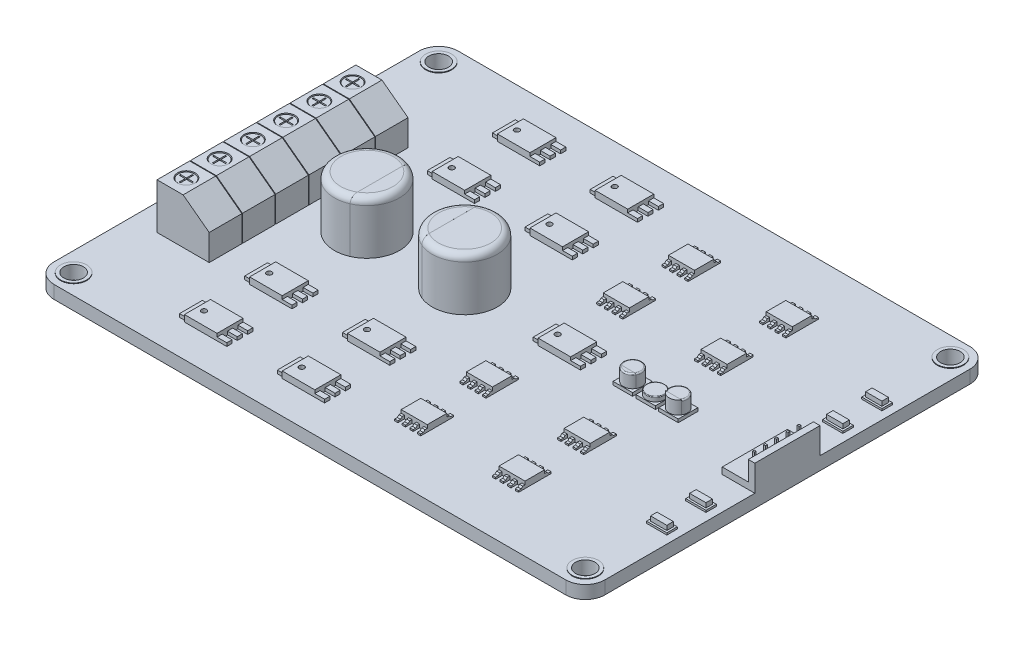
from build123d import *

# Parameters (mm, degrees)
SKETCH1_R                 = 1.5
BOSS_EXTRUDE1_DEPTH       = 2
BOSS_EXTRUDE3_DEPTH       = 5
SKETCH9_R                 = 1.35
SKETCH9_R_2               = 1.25
CUT_EXTRUDE2_DEPTH        = 2.5
SKETCH9_4_R               = 1.25
CUT_EXTRUDE4_DEPTH        = 0.1
SKETCH9_3_W               = 2
SKETCH9_3_H               = 0.2
CUT_EXTRUDE3_DEPTH        = 0.5
LPATTERN1_COUNT           = 3
LPATTERN1_PITCH           = 5.1
LPATTERN2_COUNT           = 4
LPATTERN2_PITCH           = 5.1
SKETCH10_R                = 2
SKETCH10_R_2              = 1.5
BOSS_EXTRUDE4_DEPTH       = 0.1
SKETCH11_R                = 5
BOSS_EXTRUDE5_DEPTH       = 8
FILLET1_R                 = 1
SKETCH12_W                = 5
SKETCH12_H                = 4
SKETCH12_R                = 0.4
BOSS_EXTRUDE6_DEPTH       = 1
SKETCH12_3_W              = 1.5
SKETCH12_3_H              = 0.800982622
SKETCH12_3_H_2            = 0.8
BOSS_EXTRUDE7_DEPTH       = 0.5
SKETCH13_W                = 3.5
SKETCH13_H                = 0.502519904
BOSS_EXTRUDE8_DEPTH       = 1
LPATTERN3_COUNT           = 2
LPATTERN3_PITCH           = 10
LPATTERN3_COUNT_DIR2      = 2
LPATTERN3_PITCH_DIR2      = 15
CUT_EXTRUDE5_START        = -8
CUT_EXTRUDE5_DEPTH        = 8
BOSS_EXTRUDE9_DEPTH       = 8
FILLET2_R                 = 1
SKETCH16_W                = 5
SKETCH16_H                = 4
SKETCH16_R                = 0.4
BOSS_EXTRUDE10_DEPTH      = 1
SKETCH16_3_W              = 1.5
SKETCH16_3_H              = 0.8
BOSS_EXTRUDE11_DEPTH      = 0.5
SKETCH17_W                = 3.5
SKETCH17_H                = 0.5
BOSS_EXTRUDE12_DEPTH      = 1
SKETCH18_W                = 4
SKETCH18_H                = 3
BOSS_EXTRUDE13_DEPTH      = 1
SKETCH18_3_W              = 0.5
SKETCH18_3_H              = 1
BOSS_EXTRUDE14_DEPTH      = 0.5
CUT_EXTRUDE6_REACH        = 62.725
LPATTERN4_COUNT           = 2
LPATTERN4_PITCH           = 10
LPATTERN4_COUNT_DIR2      = 2
LPATTERN4_PITCH_DIR2      = 15
SKETCH20_W                = 3
SKETCH20_H                = 3
BOSS_EXTRUDE15_DEPTH      = 0.5
LPATTERN5_COUNT           = 3
LPATTERN5_PITCH           = 3.5
SKETCH21_R                = 1.4
BOSS_EXTRUDE16_DEPTH      = 2
CUT_EXTRUDE7_START        = -2
CUT_EXTRUDE7_DEPTH        = 2
BOSS_EXTRUDE17_START      = -2
BOSS_EXTRUDE17_DEPTH      = 2
FILLET3_R                 = 0.2
FILLET4_R                 = 0.2
LPATTERN6_COUNT           = 2
LPATTERN6_PITCH           = 7
FILLET4_OF_LPATTERN6_R    = 0.2
SKETCH24_R                = 1.4
BOSS_EXTRUDE18_DEPTH      = 0.7
FILLET5_R                 = 0.1
SKETCH25_W                = 5
SKETCH25_H                = 10
BOSS_EXTRUDE19_DEPTH      = 1
SKETCH26_W                = 1
SKETCH26_H                = 10
BOSS_EXTRUDE20_DEPTH      = 3
SKETCH27_W                = 0.3
SKETCH27_H                = 0.3
BOSS_EXTRUDE21_DEPTH      = 3
SKETCH28_W                = 2.5
SKETCH28_H                = 1
BOSS_EXTRUDE22_DEPTH      = 1
SKETCH29_W                = 3.1
SKETCH29_H                = 1.6
BOSS_EXTRUDE23_DEPTH      = 0.3
LPATTERN7_COUNT           = 2
LPATTERN7_PITCH           = 6
MIRROR1_COPY_1_SKETCH_W   = 5
MIRROR1_COPY_1_SKETCH_H   = 4
MIRROR1_COPY_1_SKETCH_R   = 0.4
MIRROR1_COPY_1_DEPTH      = 1
MIRROR1_COPY_2_SKETCH_W   = 5
MIRROR1_COPY_2_SKETCH_H   = 4
MIRROR1_COPY_2_SKETCH_R   = 0.4
MIRROR1_COPY_2_DEPTH      = 1
MIRROR1_COPY_3_SKETCH_W   = 5
MIRROR1_COPY_3_SKETCH_H   = 4
MIRROR1_COPY_3_SKETCH_R   = 0.4
MIRROR1_COPY_3_DEPTH      = 1
MIRROR1_COPY_4_SKETCH_W   = 1.5
MIRROR1_COPY_4_SKETCH_H   = 0.800982622
MIRROR1_COPY_4_SKETCH_H_2 = 0.8
MIRROR1_COPY_4_DEPTH      = 0.5
MIRROR1_COPY_5_SKETCH_W   = 1.5
MIRROR1_COPY_5_SKETCH_H   = 0.800982622
MIRROR1_COPY_5_SKETCH_H_2 = 0.8
MIRROR1_COPY_5_DEPTH      = 0.5
MIRROR1_COPY_6_SKETCH_W   = 1.5
MIRROR1_COPY_6_SKETCH_H   = 0.800982622
MIRROR1_COPY_6_SKETCH_H_2 = 0.8
MIRROR1_COPY_6_DEPTH      = 0.5
MIRROR1_COPY_7_SKETCH_W   = 3.5
MIRROR1_COPY_7_SKETCH_H   = 0.502519904
MIRROR1_COPY_7_DEPTH      = 1
MIRROR1_COPY_8_SKETCH_W   = 3.5
MIRROR1_COPY_8_SKETCH_H   = 0.502519904
MIRROR1_COPY_8_DEPTH      = 1
MIRROR1_COPY_9_SKETCH_W   = 3.5
MIRROR1_COPY_9_SKETCH_H   = 0.502519904
MIRROR1_COPY_9_DEPTH      = 1
MIRROR1_COPY_10_SKETCH_W  = 4
MIRROR1_COPY_10_SKETCH_H  = 3
MIRROR1_COPY_10_DEPTH     = 1
MIRROR1_COPY_11_SKETCH_W  = 4
MIRROR1_COPY_11_SKETCH_H  = 3
MIRROR1_COPY_11_DEPTH     = 1
MIRROR1_COPY_12_SKETCH_W  = 4
MIRROR1_COPY_12_SKETCH_H  = 3
MIRROR1_COPY_12_DEPTH     = 1
MIRROR1_COPY_13_SKETCH_W  = 0.5
MIRROR1_COPY_13_SKETCH_H  = 1
MIRROR1_COPY_13_DEPTH     = 0.5
MIRROR1_COPY_14_SKETCH_W  = 0.5
MIRROR1_COPY_14_SKETCH_H  = 1
MIRROR1_COPY_14_DEPTH     = 0.5
MIRROR1_COPY_15_SKETCH_W  = 0.5
MIRROR1_COPY_15_SKETCH_H  = 1
MIRROR1_COPY_15_DEPTH     = 0.5
MIRROR1_COPY_16_REACH     = 62.725
MIRROR1_COPY_17_REACH     = 62.725
MIRROR1_COPY_18_REACH     = 62.725
MIRROR1_COPY_19_SKETCH_W  = 2.5
MIRROR1_COPY_19_SKETCH_H  = 1
MIRROR1_COPY_19_DEPTH     = 1
MIRROR1_COPY_20_SKETCH_W  = 3.1
MIRROR1_COPY_20_SKETCH_H  = 1.6
MIRROR1_COPY_20_DEPTH     = 0.3


with BuildPart() as part:
    # Sketch1 → Boss-Extrude1 (new body)
    with BuildSketch(Plane(origin=(0, 0, 0), x_dir=(1, 0, 0), z_dir=(0, 1, 0))):
        with BuildLine():
            Line((39.25, -31), (-39.25, -31))
            ThreePointArc((-39.25, -31), (-41.371320344, -30.121320344), (-42.25, -28))
            Line((-42.25, -28), (-42.25, 28))
            ThreePointArc((-42.25, 28), (-41.371320344, 30.121320344), (-39.25, 31))
            Line((-39.25, 31), (39.25, 31))
            ThreePointArc((39.25, 31), (41.371320344, 30.121320344), (42.25, 28))
            Line((42.25, 28), (42.25, -28))
            ThreePointArc((42.25, -28), (41.371320344, -30.121320344), (39.25, -31))
        make_face()
        with Locations(Location((-39.25, 28, 0), (0, 0, 270))):
            Circle(SKETCH1_R, mode=Mode.SUBTRACT)
        with Locations(Location((39.25, 28, 0), (0, 0, 270))):
            Circle(SKETCH1_R, mode=Mode.SUBTRACT)
        with Locations(Location((39.25, -28, 0), (0, 0, 270))):
            Circle(SKETCH1_R, mode=Mode.SUBTRACT)
        with Locations(Location((-39.25, -28, 0), (0, 0, 270))):
            Circle(SKETCH1_R, mode=Mode.SUBTRACT)
    extrude(amount=BOSS_EXTRUDE1_DEPTH)

    # Sketch8 → Boss-Extrude3 (add)
    with BuildSketch(Plane.XY.offset(1)):
        Polygon((-38.25, 2), (-38.25, 9), (-34.25, 9), (-30.25, 6), (-30.25, 2), align=None)
    boss_extrude3 = extrude(amount=BOSS_EXTRUDE3_DEPTH)

    # Sketch9 → Cut-Extrude2 (cut)
    with BuildSketch(Plane(origin=(0, 9, 0), x_dir=(1, 0, 0), z_dir=(0, 1, 0))):
        with Locations(Location((-36.25, -3.5, 0), (0, 0, 270))):
            Circle(SKETCH9_R)
        with Locations(Location((-36.25, -3.5, 0), (0, 0, 270))):
            Circle(SKETCH9_R_2, mode=Mode.SUBTRACT)
    cut_extrude2 = extrude(amount=-CUT_EXTRUDE2_DEPTH, mode=Mode.SUBTRACT)

    # Sketch9<4> → Cut-Extrude4 (cut)
    with BuildSketch(Plane(origin=(0, 9, 0), x_dir=(1, 0, 0), z_dir=(0, 1, 0))):
        with Locations(Location((-36.25, -3.5, 0), (0, 0, 270))):
            Circle(SKETCH9_4_R)
    cut_extrude4 = extrude(amount=-CUT_EXTRUDE4_DEPTH, mode=Mode.SUBTRACT)

    # Sketch9<3> → Cut-Extrude3 (cut)
    with BuildSketch(Plane(origin=(0, 9, 0), x_dir=(1, 0, 0), z_dir=(0, 1, 0))):
        Polygon((-36.15, -4.5), (-36.15, -3.5), (-36.15, -2.5), (-36.35, -2.5), (-36.35, -3.5), (-36.35, -4.5), align=None)
        with Locations((-36.25, -3.5)):
            Rectangle(SKETCH9_3_W, SKETCH9_3_H)
    cut_extrude3 = extrude(amount=-CUT_EXTRUDE3_DEPTH, mode=Mode.SUBTRACT)

    # LPattern1: Boss-Extrude3, Cut-Extrude2, Cut-Extrude4, Cut-Extrude3 ×3
    with Locations(*[(0, 0, i * LPATTERN1_PITCH) for i in range(1, LPATTERN1_COUNT)]):
        add(boss_extrude3)
        add(cut_extrude2, mode=Mode.SUBTRACT)
        add(cut_extrude4, mode=Mode.SUBTRACT)
        add(cut_extrude3, mode=Mode.SUBTRACT)

    # LPattern2: Boss-Extrude3, Cut-Extrude2, Cut-Extrude4, Cut-Extrude3 ×4
    with Locations(*[(0, 0, -i * LPATTERN2_PITCH) for i in range(1, LPATTERN2_COUNT)]):
        add(boss_extrude3)
        add(cut_extrude2, mode=Mode.SUBTRACT)
        add(cut_extrude4, mode=Mode.SUBTRACT)
        add(cut_extrude3, mode=Mode.SUBTRACT)

    # Sketch10 → Boss-Extrude4 (add)
    # profile 1 of 4: a face of its own
    with BuildSketch(Plane(origin=(0, 2, 0), x_dir=(1, 0, 0), z_dir=(0, 1, 0))):
        with Locations(Location((-39.25, 28, 0), (0, 0, 90))):
            Circle(SKETCH10_R)
        with Locations(Location((-39.25, 28, 0), (0, 0, 270))):
            Circle(SKETCH10_R_2, mode=Mode.SUBTRACT)
    # profile 2 of 4: a face of its own
    with BuildSketch(Plane(origin=(0, 2, 0), x_dir=(1, 0, 0), z_dir=(0, 1, 0))):
        with Locations(Location((39.25, 28, 0), (0, 0, 90))):
            Circle(SKETCH10_R)
        with Locations(Location((39.25, 28, 0), (0, 0, 270))):
            Circle(SKETCH10_R_2, mode=Mode.SUBTRACT)
    # profile 3 of 4: a face of its own
    with BuildSketch(Plane(origin=(0, 2, 0), x_dir=(1, 0, 0), z_dir=(0, 1, 0))):
        with Locations(Location((39.25, -28, 0), (0, 0, 90))):
            Circle(SKETCH10_R)
        with Locations(Location((39.25, -28, 0), (0, 0, 270))):
            Circle(SKETCH10_R_2, mode=Mode.SUBTRACT)
    # profile 4 of 4: a face of its own
    with BuildSketch(Plane(origin=(0, 2, 0), x_dir=(1, 0, 0), z_dir=(0, 1, 0))):
        with Locations(Location((-39.25, -28, 0), (0, 0, 90))):
            Circle(SKETCH10_R)
        with Locations(Location((-39.25, -28, 0), (0, 0, 270))):
            Circle(SKETCH10_R_2, mode=Mode.SUBTRACT)
    extrude(amount=BOSS_EXTRUDE4_DEPTH)

    # Sketch11 → Boss-Extrude5 (add)
    with BuildSketch(Plane(origin=(0, 2, 0), x_dir=(1, 0, 0), z_dir=(0, 1, 0))):
        with Locations(Location((-22.25, 0, 0), (0, 0, 90))):
            Circle(SKETCH11_R)
        with Locations(Location((-7.25, 0, 0), (0, 0, 90))):
            Circle(SKETCH11_R)
    extrude(amount=BOSS_EXTRUDE5_DEPTH)

    # Fillet1
    fillet1_edges = [part.edges().sort_by_distance(p)[0] for p in [
        (-22.25, 10, 5),
        (-7.25, 10, 5),
    ]]
    fillet(fillet1_edges, radius=FILLET1_R)

    # Sketch12 → Boss-Extrude6 (add)
    with BuildSketch(Plane(origin=(0, 2, 0), x_dir=(1, 0, 0), z_dir=(0, 1, 0))):
        with Locations((-21.75, -14)):
            Rectangle(SKETCH12_W, SKETCH12_H)
        with Locations(Location((-23.25, -14, 0), (0, 0, 270))):
            Circle(SKETCH12_R, mode=Mode.SUBTRACT)
    boss_extrude6 = extrude(amount=BOSS_EXTRUDE6_DEPTH)

    # Sketch12<3> → Boss-Extrude7 (add)
    with BuildSketch(Plane(origin=(0, 2, 0), x_dir=(1, 0, 0), z_dir=(0, 1, 0))):
        with Locations((-18.5, -12.400491311)):
            Rectangle(SKETCH12_3_W, SKETCH12_3_H)
        with Locations((-18.5, -14.000982622)):
            Rectangle(SKETCH12_3_W, SKETCH12_3_H_2)
        with Locations((-18.5, -15.6)):
            Rectangle(SKETCH12_3_W, SKETCH12_3_H_2)
    boss_extrude7 = extrude(amount=BOSS_EXTRUDE7_DEPTH)

    # Sketch13 → Boss-Extrude8 (add)
    with BuildSketch(Plane.ZY.offset(24.25)):
        with Locations((14, 2.251259952)):
            Rectangle(SKETCH13_W, SKETCH13_H)
    boss_extrude8 = extrude(amount=BOSS_EXTRUDE8_DEPTH)

    # LPattern3: Boss-Extrude6, Boss-Extrude7, Boss-Extrude8 2 × 2
    with Locations(*[(j * LPATTERN3_PITCH_DIR2, 0, i * LPATTERN3_PITCH) for i in range(LPATTERN3_COUNT) for j in range(LPATTERN3_COUNT_DIR2) if (i, j) != (0, 0)]):
        add(boss_extrude6)
        add(boss_extrude7)
        add(boss_extrude8)

    # Sketch14 → Cut-Extrude5 (cut)
    with BuildSketch(Plane(origin=(0, 10, 0), x_dir=(1, 0, 0), z_dir=(0, 1, 0)).offset(CUT_EXTRUDE5_START)):
        with BuildLine():
            ThreePointArc((-20.25, -4.582575695), (-17.25, 0), (-20.25, 4.582575695))
            Line((-20.25, 4.582575695), (-20.25, -4.582575695))
        make_face()
        with BuildLine():
            Line((-9.25, -4.582575695), (-9.25, 4.582575695))
            ThreePointArc((-9.25, 4.582575695), (-12.25, 0), (-9.25, -4.582575695))
        make_face()
    extrude(amount=CUT_EXTRUDE5_DEPTH, mode=Mode.SUBTRACT)

    # Boss-Extrude9: read off the stored shape, not the designer's step
    # Boss-Extrude9 outline → Boss-Extrude9 (add)
    with BuildSketch(Plane(origin=(0, 2, 0), x_dir=(1, 0, 0), z_dir=(0, 1, 0))):
        with BuildLine():
            ThreePointArc((-9.251, 4.582139129), (-12.25, 0), (-9.251, -4.582139129))
            Line((-9.251, -4.582139129), (-9.251, 4.582139129))
        make_face()
        with BuildLine():
            ThreePointArc((-20.249, -4.582139129), (-17.25, 0), (-20.249, 4.582139129))
            Line((-20.249, 4.582139129), (-20.249, -4.582139129))
        make_face()
    extrude(amount=BOSS_EXTRUDE9_DEPTH)

    # Fillet2
    fillet2_edges = [part.edges().sort_by_distance(p)[0] for p in [
        (-17.25, 10, 0),
        (-12.25, 10, 0),
    ]]
    fillet(fillet2_edges, radius=FILLET2_R)

    # Sketch16 → Boss-Extrude10 (add)
    with BuildSketch(Plane(origin=(0, 2, 0), x_dir=(1, 0, 0), z_dir=(0, 1, 0))):
        with Locations((8.5, 0)):
            Rectangle(SKETCH16_W, SKETCH16_H)
        with Locations(Location((7, 0, 0), (0, 0, 270))):
            Circle(SKETCH16_R, mode=Mode.SUBTRACT)
    extrude(amount=BOSS_EXTRUDE10_DEPTH)

    # Sketch16<3> → Boss-Extrude11 (add)
    with BuildSketch(Plane(origin=(0, 2, 0), x_dir=(1, 0, 0), z_dir=(0, 1, 0))):
        with Locations((11.75, 1.6)):
            Rectangle(SKETCH16_3_W, SKETCH16_3_H)
        with Locations((11.75, 0)):
            Rectangle(SKETCH16_3_W, SKETCH16_3_H)
        with Locations((11.75, -1.6)):
            Rectangle(SKETCH16_3_W, SKETCH16_3_H)
    extrude(amount=BOSS_EXTRUDE11_DEPTH)

    # Sketch17 → Boss-Extrude12 (add)
    with BuildSketch(Plane.ZY.offset(-6)):
        with Locations((0, 2.25)):
            Rectangle(SKETCH17_W, SKETCH17_H)
    extrude(amount=BOSS_EXTRUDE12_DEPTH)

    # Sketch18 → Boss-Extrude13 (add)
    with BuildSketch(Plane(origin=(0, 2, 0), x_dir=(1, 0, 0), z_dir=(0, 1, 0))):
        with Locations((7, -10.5)):
            Rectangle(SKETCH18_W, SKETCH18_H)
    boss_extrude13 = extrude(amount=BOSS_EXTRUDE13_DEPTH)

    # Sketch18<3> → Boss-Extrude14 (add)
    with BuildSketch(Plane(origin=(0, 2, 0), x_dir=(1, 0, 0), z_dir=(0, 1, 0))):
        with Locations((8.75, -12.5)):
            Rectangle(SKETCH18_3_W, SKETCH18_3_H)
        with Locations((7.583333333, -12.5)):
            Rectangle(SKETCH18_3_W, SKETCH18_3_H)
        with Locations((6.413333333, -12.5)):
            Rectangle(SKETCH18_3_W, SKETCH18_3_H)
        with Locations((5.25, -12.5)):
            Rectangle(SKETCH18_3_W, SKETCH18_3_H)
        with Locations((8.75, -8.5)):
            Rectangle(SKETCH18_3_W, SKETCH18_3_H)
        with Locations((7.583333333, -8.5)):
            Rectangle(SKETCH18_3_W, SKETCH18_3_H)
        with Locations((6.413333333, -8.5)):
            Rectangle(SKETCH18_3_W, SKETCH18_3_H)
        with Locations((5.25, -8.5)):
            Rectangle(SKETCH18_3_W, SKETCH18_3_H)
    boss_extrude14 = extrude(amount=BOSS_EXTRUDE14_DEPTH)

    # Cut-Extrude6: up to this face of the body (flat: up to its plane)
    cut_extrude6_end = Plane(part.part.faces().sort_by_distance((5, 2.25, 0))[0])
    # Sketch19 → Cut-Extrude6 (cut, up to the picked face)
    with BuildSketch(Plane(origin=(9, 0, 0), x_dir=(0, 0, -1), z_dir=(1, 0, 0)), mode=Mode.PRIVATE) as cut_extrude6_sk1:
        Polygon((-12.347582856, 2.5), (-13, 2.5), (-13, 2.25), (-12.597582856, 2.25), align=None)
    cut_extrude6_tool1 = split(extrude(cut_extrude6_sk1.sketch, amount=-CUT_EXTRUDE6_REACH, mode=Mode.PRIVATE), bisect_by=cut_extrude6_end, keep=Keep.BOTH, mode=Mode.PRIVATE)
    # Sketch19 → Cut-Extrude6 (cut, up to the picked face)
    with BuildSketch(Plane(origin=(9, 0, 0), x_dir=(0, 0, -1), z_dir=(1, 0, 0)), mode=Mode.PRIVATE) as cut_extrude6_sk2:
        Polygon((-8.652417144, 2.5), (-8.402417144, 2.25), (-8, 2.25), (-8, 2.5), align=None)
    cut_extrude6_tool2 = split(extrude(cut_extrude6_sk2.sketch, amount=-CUT_EXTRUDE6_REACH, mode=Mode.PRIVATE), bisect_by=cut_extrude6_end, keep=Keep.BOTH, mode=Mode.PRIVATE)
    cut_extrude6_1 = cut_extrude6_tool1.solids().sort_by(Axis((9, 2.384875, 12.731354), (-1, 0, 0)))[0]
    add(cut_extrude6_1, mode=Mode.SUBTRACT)
    cut_extrude6_2 = cut_extrude6_tool2.solids().sort_by(Axis((9, 2.384875, 8.268646), (-1, 0, 0)))[0]
    add(cut_extrude6_2, mode=Mode.SUBTRACT)
    cut_extrude6 = cut_extrude6_1 + cut_extrude6_2  # Cut-Extrude6 as one shape, for the pattern or mirror that repeats it

    # LPattern4: Boss-Extrude13, Boss-Extrude14, Cut-Extrude6 2 × 2
    with Locations(*[(j * LPATTERN4_PITCH_DIR2, 0, i * LPATTERN4_PITCH) for i in range(LPATTERN4_COUNT) for j in range(LPATTERN4_COUNT_DIR2) if (i, j) != (0, 0)]):
        add(boss_extrude13)
        add(boss_extrude14)
        add(cut_extrude6, mode=Mode.SUBTRACT)

    # Sketch20 → Boss-Extrude15 (add)
    with BuildSketch(Plane(origin=(0, 2, 0), x_dir=(1, 0, 0), z_dir=(0, 1, 0))):
        with Locations((18.5, 0)):
            Rectangle(SKETCH20_W, SKETCH20_H)
    boss_extrude15 = extrude(amount=BOSS_EXTRUDE15_DEPTH)

    # LPattern5: Boss-Extrude15 ×3
    with Locations(*[(i * LPATTERN5_PITCH, 0, 0) for i in range(1, LPATTERN5_COUNT)]):
        add(boss_extrude15)

    # Sketch21 → Boss-Extrude16 (add)
    with BuildSketch(Plane(origin=(0, 2.5, 0), x_dir=(1, 0, 0), z_dir=(0, 1, 0))):
        with Locations(Location((18.5, 0, 0), (0, 0, 270))):
            Circle(SKETCH21_R)
    boss_extrude16 = extrude(amount=BOSS_EXTRUDE16_DEPTH)

    # Sketch22 → Cut-Extrude7 (cut)
    with BuildSketch(Plane(origin=(0, 4.5, 0), x_dir=(1, 0, 0), z_dir=(0, 1, 0)).offset(CUT_EXTRUDE7_START)):
        with BuildLine():
            Line((19.712435565, -0.7), (17.287564435, -0.7))
            ThreePointArc((17.287564435, -0.7), (18.5, -1.4), (19.712435565, -0.7))
        make_face()
    cut_extrude7 = extrude(amount=CUT_EXTRUDE7_DEPTH, mode=Mode.SUBTRACT)

    # Boss-Extrude17: read off the stored shape, not the designer's step
    # Boss-Extrude17 outline → Boss-Extrude17 (add)
    with BuildSketch(Plane(origin=(0, 4.5, 0), x_dir=(1, 0, 0), z_dir=(0, 1, 0)).offset(BOSS_EXTRUDE17_START)):
        with BuildLine():
            Line((19.711857665, -0.701), (17.288142335, -0.701))
            ThreePointArc((17.288142335, -0.701), (18.5, -1.4), (19.711857665, -0.701))
        make_face()
    boss_extrude17 = extrude(amount=BOSS_EXTRUDE17_DEPTH)

    # Fillet3
    fillet3_edges = [part.edges().sort_by_distance(p)[0] for p in [
        (18.5, 4.5, 1.4),
    ]]
    fillet(fillet3_edges, radius=FILLET3_R)

    # Fillet4
    fillet4_edges = [part.edges().sort_by_distance(p)[0] for p in [
        (18.5, 4.5, -1.4),
    ]]
    fillet(fillet4_edges, radius=FILLET4_R)

    # LPattern6: Boss-Extrude16, Cut-Extrude7, Boss-Extrude17 ×2
    with Locations(*[(i * LPATTERN6_PITCH, 0, 0) for i in range(1, LPATTERN6_COUNT)]):
        add(boss_extrude16)
        add(cut_extrude7, mode=Mode.SUBTRACT)
        add(boss_extrude17)

    # Fillet4 of LPattern6
    fillet4_of_lpattern6_edges = [part.edges().sort_by_distance(p)[0] for p in [
        (25.5, 4.5, -1.4),
    ]]
    fillet(fillet4_of_lpattern6_edges, radius=FILLET4_OF_LPATTERN6_R)

    # Sketch24 → Boss-Extrude18 (add)
    with BuildSketch(Plane(origin=(0, 2.5, 0), x_dir=(1, 0, 0), z_dir=(0, 1, 0))):
        with Locations(Location((22, 0, 0), (0, 0, 270))):
            Circle(SKETCH24_R)
    extrude(amount=BOSS_EXTRUDE18_DEPTH)

    # Fillet5
    fillet5_edges = [part.edges().sort_by_distance(p)[0] for p in [
        (22, 3.2, -1.4),
    ]]
    fillet(fillet5_edges, radius=FILLET5_R)

    # Sketch25 → Boss-Extrude19 (add)
    with BuildSketch(Plane(origin=(0, 2, 0), x_dir=(1, 0, 0), z_dir=(0, 1, 0))):
        with Locations((39.75, 0)):
            Rectangle(SKETCH25_W, SKETCH25_H)
    extrude(amount=BOSS_EXTRUDE19_DEPTH)

    # Sketch26 → Boss-Extrude20 (add)
    with BuildSketch(Plane(origin=(0, 3, 0), x_dir=(1, 0, 0), z_dir=(0, 1, 0))):
        with Locations((41.75, 0)):
            Rectangle(SKETCH26_W, SKETCH26_H)
    extrude(amount=BOSS_EXTRUDE20_DEPTH)

    # Sketch27 → Boss-Extrude21 (add)
    with BuildSketch(Plane(origin=(0, 3, 0), x_dir=(1, 0, 0), z_dir=(0, 1, 0))):
        with Locations((40.6, 3.43)):
            Rectangle(SKETCH27_W, SKETCH27_H)
        with Locations((40.6, 1.713333333)):
            Rectangle(SKETCH27_W, SKETCH27_H)
        with Locations((40.6, -0.003333333)):
            Rectangle(SKETCH27_W, SKETCH27_H)
        with Locations((40.6, -1.72)):
            Rectangle(SKETCH27_W, SKETCH27_H)
        with Locations((40.6, -3.436666667)):
            Rectangle(SKETCH27_W, SKETCH27_H)
    extrude(amount=BOSS_EXTRUDE21_DEPTH)

    # Sketch28 → Boss-Extrude22 (add)
    with BuildSketch(Plane(origin=(0, 2, 0), x_dir=(1, 0, 0), z_dir=(0, 1, 0))):
        with Locations((39.5, -10.5)):
            Rectangle(SKETCH28_W, SKETCH28_H)
    boss_extrude22 = extrude(amount=BOSS_EXTRUDE22_DEPTH)

    # Sketch29 → Boss-Extrude23 (add)
    with BuildSketch(Plane(origin=(0, 2, 0), x_dir=(1, 0, 0), z_dir=(0, 1, 0))):
        with Locations((39.5, -10.5)):
            Rectangle(SKETCH29_W, SKETCH29_H)
    boss_extrude23 = extrude(amount=BOSS_EXTRUDE23_DEPTH)

    # LPattern7: Boss-Extrude22, Boss-Extrude23 ×2
    with Locations(*[(0, 0, i * LPATTERN7_PITCH) for i in range(1, LPATTERN7_COUNT)]):
        add(boss_extrude22)
        add(boss_extrude23)

    # Mirror1: Boss-Extrude6, Boss-Extrude7, Boss-Extrude8, Boss-Extrude13, Boss-Extrude14, Cut-Extrude6, Boss-Extrude22, Boss-Extrude23 across plane
    add(boss_extrude6.mirror(Plane.XY))
    add(boss_extrude7.mirror(Plane.XY))
    add(boss_extrude8.mirror(Plane.XY))
    add(boss_extrude13.mirror(Plane.XY))
    add(boss_extrude14.mirror(Plane.XY))
    add(cut_extrude6.mirror(Plane.XY), mode=Mode.SUBTRACT)
    add(boss_extrude22.mirror(Plane.XY))
    add(boss_extrude23.mirror(Plane.XY))

    # Mirror1 copy 1 sketch → Mirror1 copy 1 (add)
    with BuildSketch(Plane(origin=(15, 2, 0), x_dir=(1, 0, 0), z_dir=(0, 1, 0))):
        with Locations((-21.75, 14)):
            Rectangle(MIRROR1_COPY_1_SKETCH_W, MIRROR1_COPY_1_SKETCH_H)
        with Locations((-23.25, 14)):
            Circle(MIRROR1_COPY_1_SKETCH_R, mode=Mode.SUBTRACT)
    extrude(amount=MIRROR1_COPY_1_DEPTH)

    # Mirror1 copy 2 sketch → Mirror1 copy 2 (add)
    with BuildSketch(Plane(origin=(0, 2, -10), x_dir=(1, 0, 0), z_dir=(0, 1, 0))):
        with Locations((-21.75, 14)):
            Rectangle(MIRROR1_COPY_2_SKETCH_W, MIRROR1_COPY_2_SKETCH_H)
        with Locations((-23.25, 14)):
            Circle(MIRROR1_COPY_2_SKETCH_R, mode=Mode.SUBTRACT)
    extrude(amount=MIRROR1_COPY_2_DEPTH)

    # Mirror1 copy 3 sketch → Mirror1 copy 3 (add)
    with BuildSketch(Plane(origin=(15, 2, -10), x_dir=(1, 0, 0), z_dir=(0, 1, 0))):
        with Locations((-21.75, 14)):
            Rectangle(MIRROR1_COPY_3_SKETCH_W, MIRROR1_COPY_3_SKETCH_H)
        with Locations((-23.25, 14)):
            Circle(MIRROR1_COPY_3_SKETCH_R, mode=Mode.SUBTRACT)
    extrude(amount=MIRROR1_COPY_3_DEPTH)

    # Mirror1 copy 4 sketch → Mirror1 copy 4 (add)
    with BuildSketch(Plane(origin=(15, 2, 0), x_dir=(1, 0, 0), z_dir=(0, 1, 0))):
        with Locations((-18.5, 12.400491311)):
            Rectangle(MIRROR1_COPY_4_SKETCH_W, MIRROR1_COPY_4_SKETCH_H)
        with Locations((-18.5, 14.000982622)):
            Rectangle(MIRROR1_COPY_4_SKETCH_W, MIRROR1_COPY_4_SKETCH_H_2)
        with Locations((-18.5, 15.6)):
            Rectangle(MIRROR1_COPY_4_SKETCH_W, MIRROR1_COPY_4_SKETCH_H_2)
    extrude(amount=MIRROR1_COPY_4_DEPTH)

    # Mirror1 copy 5 sketch → Mirror1 copy 5 (add)
    with BuildSketch(Plane(origin=(0, 2, -10), x_dir=(1, 0, 0), z_dir=(0, 1, 0))):
        with Locations((-18.5, 12.400491311)):
            Rectangle(MIRROR1_COPY_5_SKETCH_W, MIRROR1_COPY_5_SKETCH_H)
        with Locations((-18.5, 14.000982622)):
            Rectangle(MIRROR1_COPY_5_SKETCH_W, MIRROR1_COPY_5_SKETCH_H_2)
        with Locations((-18.5, 15.6)):
            Rectangle(MIRROR1_COPY_5_SKETCH_W, MIRROR1_COPY_5_SKETCH_H_2)
    extrude(amount=MIRROR1_COPY_5_DEPTH)

    # Mirror1 copy 6 sketch → Mirror1 copy 6 (add)
    with BuildSketch(Plane(origin=(15, 2, -10), x_dir=(1, 0, 0), z_dir=(0, 1, 0))):
        with Locations((-18.5, 12.400491311)):
            Rectangle(MIRROR1_COPY_6_SKETCH_W, MIRROR1_COPY_6_SKETCH_H)
        with Locations((-18.5, 14.000982622)):
            Rectangle(MIRROR1_COPY_6_SKETCH_W, MIRROR1_COPY_6_SKETCH_H_2)
        with Locations((-18.5, 15.6)):
            Rectangle(MIRROR1_COPY_6_SKETCH_W, MIRROR1_COPY_6_SKETCH_H_2)
    extrude(amount=MIRROR1_COPY_6_DEPTH)

    # Mirror1 copy 7 sketch → Mirror1 copy 7 (add)
    with BuildSketch(Plane(origin=(-9.25, 0, 0), x_dir=(0, 0, -1), z_dir=(-1, 0, 0))):
        with Locations((14, -2.251259952)):
            Rectangle(MIRROR1_COPY_7_SKETCH_W, MIRROR1_COPY_7_SKETCH_H)
    extrude(amount=MIRROR1_COPY_7_DEPTH)

    # Mirror1 copy 8 sketch → Mirror1 copy 8 (add)
    with BuildSketch(Plane(origin=(-24.25, 0, -10), x_dir=(0, 0, -1), z_dir=(-1, 0, 0))):
        with Locations((14, -2.251259952)):
            Rectangle(MIRROR1_COPY_8_SKETCH_W, MIRROR1_COPY_8_SKETCH_H)
    extrude(amount=MIRROR1_COPY_8_DEPTH)

    # Mirror1 copy 9 sketch → Mirror1 copy 9 (add)
    with BuildSketch(Plane(origin=(-9.25, 0, -10), x_dir=(0, 0, -1), z_dir=(-1, 0, 0))):
        with Locations((14, -2.251259952)):
            Rectangle(MIRROR1_COPY_9_SKETCH_W, MIRROR1_COPY_9_SKETCH_H)
    extrude(amount=MIRROR1_COPY_9_DEPTH)

    # Mirror1 copy 10 sketch → Mirror1 copy 10 (add)
    with BuildSketch(Plane(origin=(15, 2, 0), x_dir=(1, 0, 0), z_dir=(0, 1, 0))):
        with Locations((7, 10.5)):
            Rectangle(MIRROR1_COPY_10_SKETCH_W, MIRROR1_COPY_10_SKETCH_H)
    extrude(amount=MIRROR1_COPY_10_DEPTH)

    # Mirror1 copy 11 sketch → Mirror1 copy 11 (add)
    with BuildSketch(Plane(origin=(0, 2, -10), x_dir=(1, 0, 0), z_dir=(0, 1, 0))):
        with Locations((7, 10.5)):
            Rectangle(MIRROR1_COPY_11_SKETCH_W, MIRROR1_COPY_11_SKETCH_H)
    extrude(amount=MIRROR1_COPY_11_DEPTH)

    # Mirror1 copy 12 sketch → Mirror1 copy 12 (add)
    with BuildSketch(Plane(origin=(15, 2, -10), x_dir=(1, 0, 0), z_dir=(0, 1, 0))):
        with Locations((7, 10.5)):
            Rectangle(MIRROR1_COPY_12_SKETCH_W, MIRROR1_COPY_12_SKETCH_H)
    extrude(amount=MIRROR1_COPY_12_DEPTH)

    # Mirror1 copy 13 sketch → Mirror1 copy 13 (add)
    with BuildSketch(Plane(origin=(15, 2, 0), x_dir=(1, 0, 0), z_dir=(0, 1, 0))):
        with Locations((8.75, 12.5)):
            Rectangle(MIRROR1_COPY_13_SKETCH_W, MIRROR1_COPY_13_SKETCH_H)
        with Locations((7.583333333, 12.5)):
            Rectangle(MIRROR1_COPY_13_SKETCH_W, MIRROR1_COPY_13_SKETCH_H)
        with Locations((6.413333333, 12.5)):
            Rectangle(MIRROR1_COPY_13_SKETCH_W, MIRROR1_COPY_13_SKETCH_H)
        with Locations((5.25, 12.5)):
            Rectangle(MIRROR1_COPY_13_SKETCH_W, MIRROR1_COPY_13_SKETCH_H)
        with Locations((8.75, 8.5)):
            Rectangle(MIRROR1_COPY_13_SKETCH_W, MIRROR1_COPY_13_SKETCH_H)
        with Locations((7.583333333, 8.5)):
            Rectangle(MIRROR1_COPY_13_SKETCH_W, MIRROR1_COPY_13_SKETCH_H)
        with Locations((6.413333333, 8.5)):
            Rectangle(MIRROR1_COPY_13_SKETCH_W, MIRROR1_COPY_13_SKETCH_H)
        with Locations((5.25, 8.5)):
            Rectangle(MIRROR1_COPY_13_SKETCH_W, MIRROR1_COPY_13_SKETCH_H)
    extrude(amount=MIRROR1_COPY_13_DEPTH)

    # Mirror1 copy 14 sketch → Mirror1 copy 14 (add)
    with BuildSketch(Plane(origin=(0, 2, -10), x_dir=(1, 0, 0), z_dir=(0, 1, 0))):
        with Locations((8.75, 12.5)):
            Rectangle(MIRROR1_COPY_14_SKETCH_W, MIRROR1_COPY_14_SKETCH_H)
        with Locations((7.583333333, 12.5)):
            Rectangle(MIRROR1_COPY_14_SKETCH_W, MIRROR1_COPY_14_SKETCH_H)
        with Locations((6.413333333, 12.5)):
            Rectangle(MIRROR1_COPY_14_SKETCH_W, MIRROR1_COPY_14_SKETCH_H)
        with Locations((5.25, 12.5)):
            Rectangle(MIRROR1_COPY_14_SKETCH_W, MIRROR1_COPY_14_SKETCH_H)
        with Locations((8.75, 8.5)):
            Rectangle(MIRROR1_COPY_14_SKETCH_W, MIRROR1_COPY_14_SKETCH_H)
        with Locations((7.583333333, 8.5)):
            Rectangle(MIRROR1_COPY_14_SKETCH_W, MIRROR1_COPY_14_SKETCH_H)
        with Locations((6.413333333, 8.5)):
            Rectangle(MIRROR1_COPY_14_SKETCH_W, MIRROR1_COPY_14_SKETCH_H)
        with Locations((5.25, 8.5)):
            Rectangle(MIRROR1_COPY_14_SKETCH_W, MIRROR1_COPY_14_SKETCH_H)
    extrude(amount=MIRROR1_COPY_14_DEPTH)

    # Mirror1 copy 15 sketch → Mirror1 copy 15 (add)
    with BuildSketch(Plane(origin=(15, 2, -10), x_dir=(1, 0, 0), z_dir=(0, 1, 0))):
        with Locations((8.75, 12.5)):
            Rectangle(MIRROR1_COPY_15_SKETCH_W, MIRROR1_COPY_15_SKETCH_H)
        with Locations((7.583333333, 12.5)):
            Rectangle(MIRROR1_COPY_15_SKETCH_W, MIRROR1_COPY_15_SKETCH_H)
        with Locations((6.413333333, 12.5)):
            Rectangle(MIRROR1_COPY_15_SKETCH_W, MIRROR1_COPY_15_SKETCH_H)
        with Locations((5.25, 12.5)):
            Rectangle(MIRROR1_COPY_15_SKETCH_W, MIRROR1_COPY_15_SKETCH_H)
        with Locations((8.75, 8.5)):
            Rectangle(MIRROR1_COPY_15_SKETCH_W, MIRROR1_COPY_15_SKETCH_H)
        with Locations((7.583333333, 8.5)):
            Rectangle(MIRROR1_COPY_15_SKETCH_W, MIRROR1_COPY_15_SKETCH_H)
        with Locations((6.413333333, 8.5)):
            Rectangle(MIRROR1_COPY_15_SKETCH_W, MIRROR1_COPY_15_SKETCH_H)
        with Locations((5.25, 8.5)):
            Rectangle(MIRROR1_COPY_15_SKETCH_W, MIRROR1_COPY_15_SKETCH_H)
    extrude(amount=MIRROR1_COPY_15_DEPTH)

    # Mirror1 copy 16: up to this face of the body (flat: up to its plane)
    mirror1_copy_16_end = Plane(part.part.faces().sort_by_distance((20, 2.25, 0))[0])
    # Mirror1 copy 16 sketch → Mirror1 copy 16 (cut, up to the picked face)
    with BuildSketch(Plane(origin=(24, 0, 0), x_dir=(0, 0, 1), z_dir=(1, 0, 0)), mode=Mode.PRIVATE) as mirror1_copy_16_sk1:
        Polygon((-12.347582856, -2.5), (-13, -2.5), (-13, -2.25), (-12.597582856, -2.25), align=None)
    mirror1_copy_16_tool1 = split(extrude(mirror1_copy_16_sk1.sketch, amount=-MIRROR1_COPY_16_REACH, mode=Mode.PRIVATE), bisect_by=mirror1_copy_16_end, keep=Keep.BOTH, mode=Mode.PRIVATE)
    # Mirror1 copy 16 sketch → Mirror1 copy 16 (cut, up to the picked face)
    with BuildSketch(Plane(origin=(24, 0, 0), x_dir=(0, 0, 1), z_dir=(1, 0, 0)), mode=Mode.PRIVATE) as mirror1_copy_16_sk2:
        Polygon((-8.652417144, -2.5), (-8.402417144, -2.25), (-8, -2.25), (-8, -2.5), align=None)
    mirror1_copy_16_tool2 = split(extrude(mirror1_copy_16_sk2.sketch, amount=-MIRROR1_COPY_16_REACH, mode=Mode.PRIVATE), bisect_by=mirror1_copy_16_end, keep=Keep.BOTH, mode=Mode.PRIVATE)
    add(mirror1_copy_16_tool1.solids().sort_by(Axis((24, 2.384875, -12.731354), (-1, 0, 0)))[0], mode=Mode.SUBTRACT)
    add(mirror1_copy_16_tool2.solids().sort_by(Axis((24, 2.384875, -8.268646), (-1, 0, 0)))[0], mode=Mode.SUBTRACT)

    # Mirror1 copy 17: up to this face of the body (flat: up to its plane)
    mirror1_copy_17_end = Plane(part.part.faces().sort_by_distance((5, 2.25, -10))[0])
    # Mirror1 copy 17 sketch → Mirror1 copy 17 (cut, up to the picked face)
    with BuildSketch(Plane(origin=(9, 0, -10), x_dir=(0, 0, 1), z_dir=(1, 0, 0)), mode=Mode.PRIVATE) as mirror1_copy_17_sk1:
        Polygon((-12.347582856, -2.5), (-13, -2.5), (-13, -2.25), (-12.597582856, -2.25), align=None)
    mirror1_copy_17_tool1 = split(extrude(mirror1_copy_17_sk1.sketch, amount=-MIRROR1_COPY_17_REACH, mode=Mode.PRIVATE), bisect_by=mirror1_copy_17_end, keep=Keep.BOTH, mode=Mode.PRIVATE)
    # Mirror1 copy 17 sketch → Mirror1 copy 17 (cut, up to the picked face)
    with BuildSketch(Plane(origin=(9, 0, -10), x_dir=(0, 0, 1), z_dir=(1, 0, 0)), mode=Mode.PRIVATE) as mirror1_copy_17_sk2:
        Polygon((-8.652417144, -2.5), (-8.402417144, -2.25), (-8, -2.25), (-8, -2.5), align=None)
    mirror1_copy_17_tool2 = split(extrude(mirror1_copy_17_sk2.sketch, amount=-MIRROR1_COPY_17_REACH, mode=Mode.PRIVATE), bisect_by=mirror1_copy_17_end, keep=Keep.BOTH, mode=Mode.PRIVATE)
    add(mirror1_copy_17_tool1.solids().sort_by(Axis((9, 2.384875, -22.731354), (-1, 0, 0)))[0], mode=Mode.SUBTRACT)
    add(mirror1_copy_17_tool2.solids().sort_by(Axis((9, 2.384875, -18.268646), (-1, 0, 0)))[0], mode=Mode.SUBTRACT)

    # Mirror1 copy 18: up to this face of the body (flat: up to its plane)
    mirror1_copy_18_end = Plane(part.part.faces().sort_by_distance((20, 2.25, -10))[0])
    # Mirror1 copy 18 sketch → Mirror1 copy 18 (cut, up to the picked face)
    with BuildSketch(Plane(origin=(24, 0, -10), x_dir=(0, 0, 1), z_dir=(1, 0, 0)), mode=Mode.PRIVATE) as mirror1_copy_18_sk1:
        Polygon((-12.347582856, -2.5), (-13, -2.5), (-13, -2.25), (-12.597582856, -2.25), align=None)
    mirror1_copy_18_tool1 = split(extrude(mirror1_copy_18_sk1.sketch, amount=-MIRROR1_COPY_18_REACH, mode=Mode.PRIVATE), bisect_by=mirror1_copy_18_end, keep=Keep.BOTH, mode=Mode.PRIVATE)
    # Mirror1 copy 18 sketch → Mirror1 copy 18 (cut, up to the picked face)
    with BuildSketch(Plane(origin=(24, 0, -10), x_dir=(0, 0, 1), z_dir=(1, 0, 0)), mode=Mode.PRIVATE) as mirror1_copy_18_sk2:
        Polygon((-8.652417144, -2.5), (-8.402417144, -2.25), (-8, -2.25), (-8, -2.5), align=None)
    mirror1_copy_18_tool2 = split(extrude(mirror1_copy_18_sk2.sketch, amount=-MIRROR1_COPY_18_REACH, mode=Mode.PRIVATE), bisect_by=mirror1_copy_18_end, keep=Keep.BOTH, mode=Mode.PRIVATE)
    add(mirror1_copy_18_tool1.solids().sort_by(Axis((24, 2.384875, -22.731354), (-1, 0, 0)))[0], mode=Mode.SUBTRACT)
    add(mirror1_copy_18_tool2.solids().sort_by(Axis((24, 2.384875, -18.268646), (-1, 0, 0)))[0], mode=Mode.SUBTRACT)

    # Mirror1 copy 19 sketch → Mirror1 copy 19 (add)
    with BuildSketch(Plane(origin=(0, 2, -6), x_dir=(1, 0, 0), z_dir=(0, 1, 0))):
        with Locations((39.5, 10.5)):
            Rectangle(MIRROR1_COPY_19_SKETCH_W, MIRROR1_COPY_19_SKETCH_H)
    extrude(amount=MIRROR1_COPY_19_DEPTH)

    # Mirror1 copy 20 sketch → Mirror1 copy 20 (add)
    with BuildSketch(Plane(origin=(0, 2, -6), x_dir=(1, 0, 0), z_dir=(0, 1, 0))):
        with Locations((39.5, 10.5)):
            Rectangle(MIRROR1_COPY_20_SKETCH_W, MIRROR1_COPY_20_SKETCH_H)
    extrude(amount=MIRROR1_COPY_20_DEPTH)


solid = part.part
